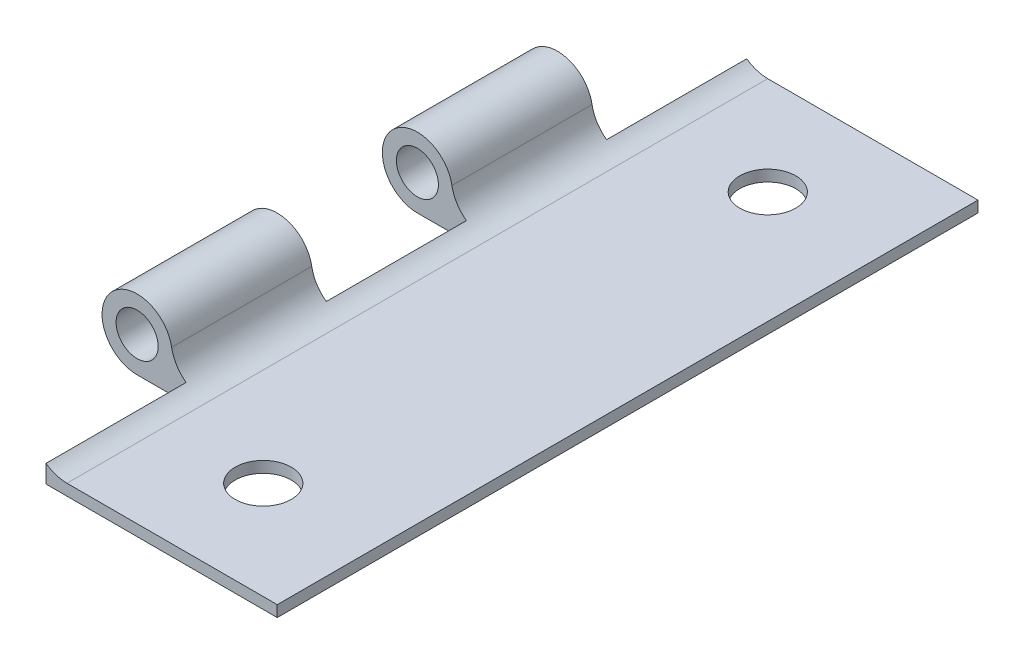
from build123d import *

# Parameters (mm, degrees)
ESBO_O1_R                = 1.5
RESSALTO_EXTRUS_O1_DEPTH = 50
ESBO_O2_R                = 2
ESBO_O2_W                = 6
ESBO_O2_H                = 10
CORTE_EXTRUS_O2_DEPTH    = 56.056788864


with BuildPart() as part:
    # Esboço1 → Ressalto-extrusão1 (new body)
    with BuildSketch(Plane.XY):
        with BuildLine():
            Line((0, 0), (-20, 0))
            ThreePointArc((-20, 0), (-22.324602514, 3.419903881), (-18.2892713, 4.32302148))
            ThreePointArc((-18.2892713, 4.32302148), (-17.800459182, 3.688284557), (-17.537523452, 2.9315197))
            ThreePointArc((-17.537523452, 2.9315197), (-16.656985327, 1.403588896), (-15, 0.8))
            Line((-15, 0.8), (0, 0.8))
            Line((0, 0.8), (0, 0))
        make_face()
        with Locations((-20, 2.5)):
            Circle(ESBO_O1_R, mode=Mode.SUBTRACT)
    extrude(amount=RESSALTO_EXTRUS_O1_DEPTH)

    # Esboço2 → Corte-extrusão2 (cut, through all)
    with BuildSketch(Plane.XZ):
        with Locations((-8, 43)):
            Circle(ESBO_O2_R)
        with Locations((-8, 7)):
            Circle(ESBO_O2_R)
        with Locations((-19.5, 5)):
            Rectangle(ESBO_O2_W, ESBO_O2_H)
        with Locations((-19.5, 25)):
            Rectangle(ESBO_O2_W, ESBO_O2_H)
        with Locations((-19.5, 45)):
            Rectangle(ESBO_O2_W, ESBO_O2_H)
    extrude(amount=-CORTE_EXTRUS_O2_DEPTH, mode=Mode.SUBTRACT)


solid = part.part
